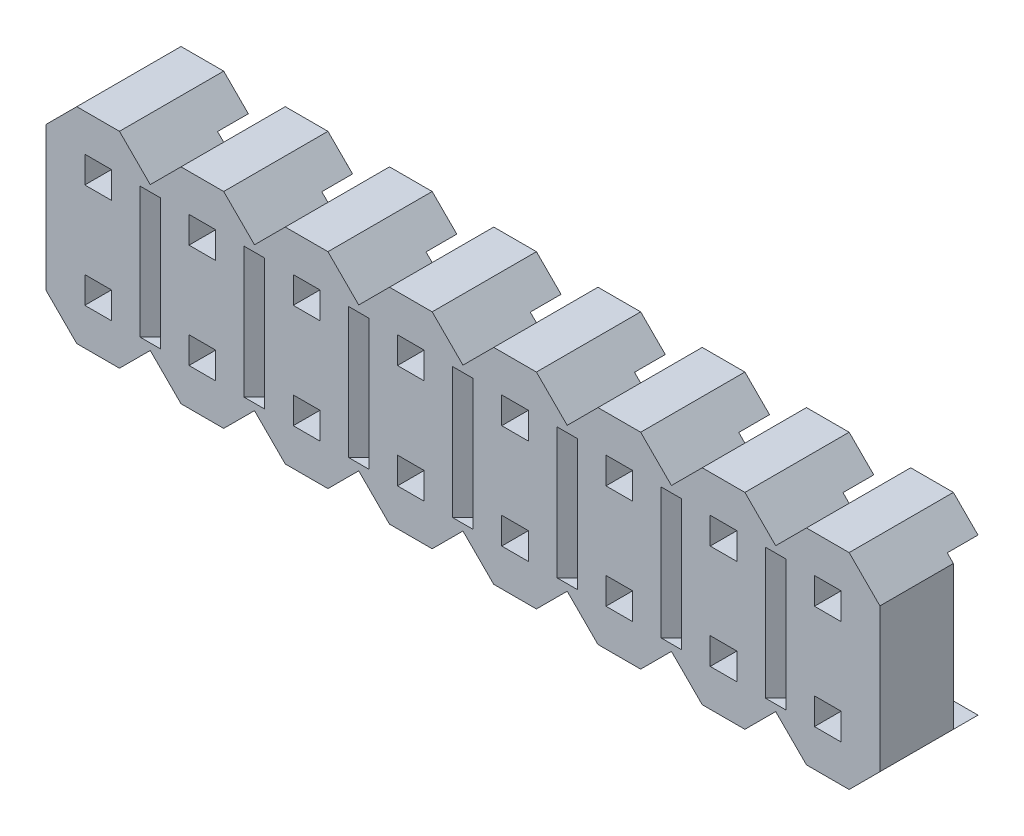
from build123d import *

# Parameters (mm, degrees)
SKETCH1_W              = 0.65
SKETCH1_H              = 0.65
EXTRUDE_1151_DEPTH     = 2.54
SKETCH6_W              = 20.32
SKETCH6_H              = 3.8
CUT_EXTRUDE_1369_DEPTH = 0.75
SKETCH7_W              = 0.5
SKETCH7_H              = 3.187
CUT_EXTRUDE_1871_DEPTH = 0.25
CHAMFER1_SIZE          = 0.25


with BuildPart() as part:
    # Sketch1 → Extrude 1151 (new body)
    with BuildSketch(Plane.XY):
        Polygon((-1.27, 1.75), (-1.27, -1.75), (-0.52, -2.5), (0.52, -2.5), (1.27, -1.75), (2.02, -2.5), (3.06, -2.5), (3.81, -1.75), (4.56, -2.5), (5.6, -2.5), (6.35, -1.75), (7.1, -2.5), (8.14, -2.5), (8.89, -1.75), (9.64, -2.5), (10.68, -2.5), (11.43, -1.75), (12.18, -2.5), (13.22, -2.5), (13.97, -1.75), (14.72, -2.5), (15.76, -2.5), (16.51, -1.75), (17.26, -2.5), (18.3, -2.5), (19.05, -1.75), (19.05, 1.75), (18.3, 2.5), (17.26, 2.5), (16.51, 1.75), (15.76, 2.5), (14.72, 2.5), (13.97, 1.75), (13.22, 2.5), (12.18, 2.5), (11.43, 1.75), (10.68, 2.5), (9.64, 2.5), (8.89, 1.75), (8.14, 2.5), (7.1, 2.5), (6.35, 1.75), (5.6, 2.5), (4.56, 2.5), (3.81, 1.75), (3.06, 2.5), (2.02, 2.5), (1.27, 1.75), (0.52, 2.5), (-0.52, 2.5), align=None)
        with Locations((2.54, 1.27)):
            Rectangle(SKETCH1_W, SKETCH1_H, mode=Mode.SUBTRACT)
        with Locations((0, 1.27)):
            Rectangle(SKETCH1_W, SKETCH1_H, mode=Mode.SUBTRACT)
        with Locations((0, -1.27)):
            Rectangle(SKETCH1_W, SKETCH1_H, mode=Mode.SUBTRACT)
        with Locations((2.54, -1.27)):
            Rectangle(SKETCH1_W, SKETCH1_H, mode=Mode.SUBTRACT)
        with Locations((5.08, 1.27)):
            Rectangle(SKETCH1_W, SKETCH1_H, mode=Mode.SUBTRACT)
        with Locations((5.08, -1.27)):
            Rectangle(SKETCH1_W, SKETCH1_H, mode=Mode.SUBTRACT)
        with Locations((7.62, 1.27)):
            Rectangle(SKETCH1_W, SKETCH1_H, mode=Mode.SUBTRACT)
        with Locations((7.62, -1.27)):
            Rectangle(SKETCH1_W, SKETCH1_H, mode=Mode.SUBTRACT)
        with Locations((10.16, 1.27)):
            Rectangle(SKETCH1_W, SKETCH1_H, mode=Mode.SUBTRACT)
        with Locations((10.16, -1.27)):
            Rectangle(SKETCH1_W, SKETCH1_H, mode=Mode.SUBTRACT)
        with Locations((12.7, 1.27)):
            Rectangle(SKETCH1_W, SKETCH1_H, mode=Mode.SUBTRACT)
        with Locations((12.7, -1.27)):
            Rectangle(SKETCH1_W, SKETCH1_H, mode=Mode.SUBTRACT)
        with Locations((15.24, 1.27)):
            Rectangle(SKETCH1_W, SKETCH1_H, mode=Mode.SUBTRACT)
        with Locations((15.24, -1.27)):
            Rectangle(SKETCH1_W, SKETCH1_H, mode=Mode.SUBTRACT)
        with Locations((17.78, 1.27)):
            Rectangle(SKETCH1_W, SKETCH1_H, mode=Mode.SUBTRACT)
        with Locations((17.78, -1.27)):
            Rectangle(SKETCH1_W, SKETCH1_H, mode=Mode.SUBTRACT)
    extrude(amount=EXTRUDE_1151_DEPTH)

    # Sketch6 → Cut-Extrude 1369 (cut)
    with BuildSketch(Plane(origin=(0, 0, 0), x_dir=(-1, 0, 0), z_dir=(0, 0, -1))):
        with Locations((-8.89, 0)):
            Rectangle(SKETCH6_W, SKETCH6_H)
    extrude(amount=-CUT_EXTRUDE_1369_DEPTH, mode=Mode.SUBTRACT)

    # Sketch7 → Cut-Extrude 1871 (cut)
    with BuildSketch(Plane.XY.offset(2.54)):
        with Locations((1.27, 0.0015)):
            Rectangle(SKETCH7_W, SKETCH7_H)
        with Locations((3.81, 0.0015)):
            Rectangle(SKETCH7_W, SKETCH7_H)
        with Locations((6.35, 0.0015)):
            Rectangle(SKETCH7_W, SKETCH7_H)
        with Locations((8.89, 0.0015)):
            Rectangle(SKETCH7_W, SKETCH7_H)
        with Locations((11.43, 0.0015)):
            Rectangle(SKETCH7_W, SKETCH7_H)
        with Locations((13.97, 0.0015)):
            Rectangle(SKETCH7_W, SKETCH7_H)
        with Locations((16.51, 0.0015)):
            Rectangle(SKETCH7_W, SKETCH7_H)
    extrude(amount=-CUT_EXTRUDE_1871_DEPTH, mode=Mode.SUBTRACT)

    # Chamfer1
    chamfer1_edges = [part.edges().sort_by_distance(p)[0] for p in [
        (1.02, 0.0015, 2.29),
        (1.52, 0.0015, 2.29),
        (3.56, 0.0015, 2.29),
        (4.06, 0.0015, 2.29),
        (6.1, 0.0015, 2.29),
        (6.6, 0.0015, 2.29),
        (8.64, 0.0015, 2.29),
        (9.14, 0.0015, 2.29),
        (11.18, 0.0015, 2.29),
        (11.68, 0.0015, 2.29),
        (13.72, 0.0015, 2.29),
        (14.22, 0.0015, 2.29),
        (16.26, 0.0015, 2.29),
        (16.76, 0.0015, 2.29),
    ]]
    chamfer(chamfer1_edges, length=CHAMFER1_SIZE - 0.0001)  # a hair under: the kernel refuses the full size


solid = part.part
